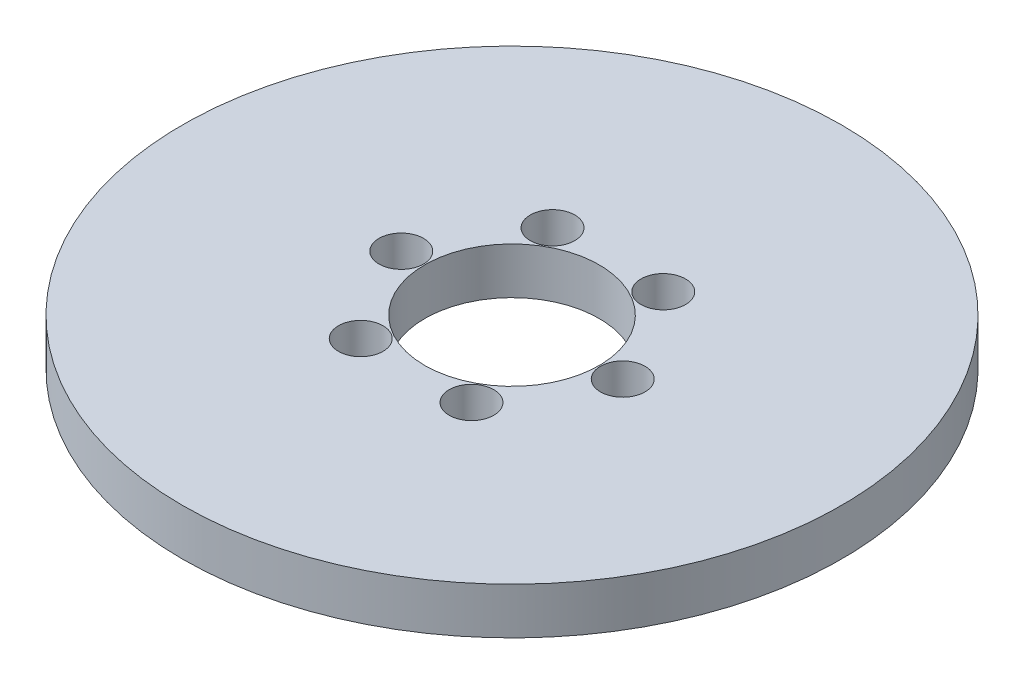
from build123d import *

# Parameters (mm, degrees)
SKETCH1_R           = 85
BOSS_EXTRUDE1_DEPTH = 12
SKETCH2_R           = 22.5
CUT_EXTRUDE1_DEPTH  = 121.805629008
SKETCH3_R           = 5.744458378
CUT_EXTRUDE2_DEPTH  = 8.640705881
CIRPATTERN1_COUNT   = 6


with BuildPart() as part:
    # Sketch1 → Boss-Extrude1 (new body)
    with BuildSketch(Plane(origin=(0, 0, 0), x_dir=(1, 0, 0), z_dir=(0, 1, 0))):
        Circle(SKETCH1_R)
    extrude(amount=BOSS_EXTRUDE1_DEPTH)

    # Sketch2 → Cut-Extrude1 (cut, through all)
    with BuildSketch(Plane(origin=(0, 0, 0), x_dir=(1, 0, 0), z_dir=(0, 1, 0))):
        Circle(SKETCH2_R)
    extrude(amount=CUT_EXTRUDE1_DEPTH, mode=Mode.SUBTRACT)

    # Sketch3 → Cut-Extrude2 (cut)
    with BuildSketch(Plane(origin=(0, 12, 0), x_dir=(1, 0, 0), z_dir=(0, 1, 0))):
        with Locations((-28.560637046, 0)):
            Circle(SKETCH3_R)
    cut_extrude2 = extrude(amount=-CUT_EXTRUDE2_DEPTH, mode=Mode.SUBTRACT)

    # CirPattern1: Cut-Extrude2 ×6 about axis
    cirpattern1_axis = Axis((0, 0, 0), (0, 1, 0))
    for i in range(1, CIRPATTERN1_COUNT):
        add(cut_extrude2.rotate(cirpattern1_axis, i * 360 / CIRPATTERN1_COUNT), mode=Mode.SUBTRACT)


solid = part.part
